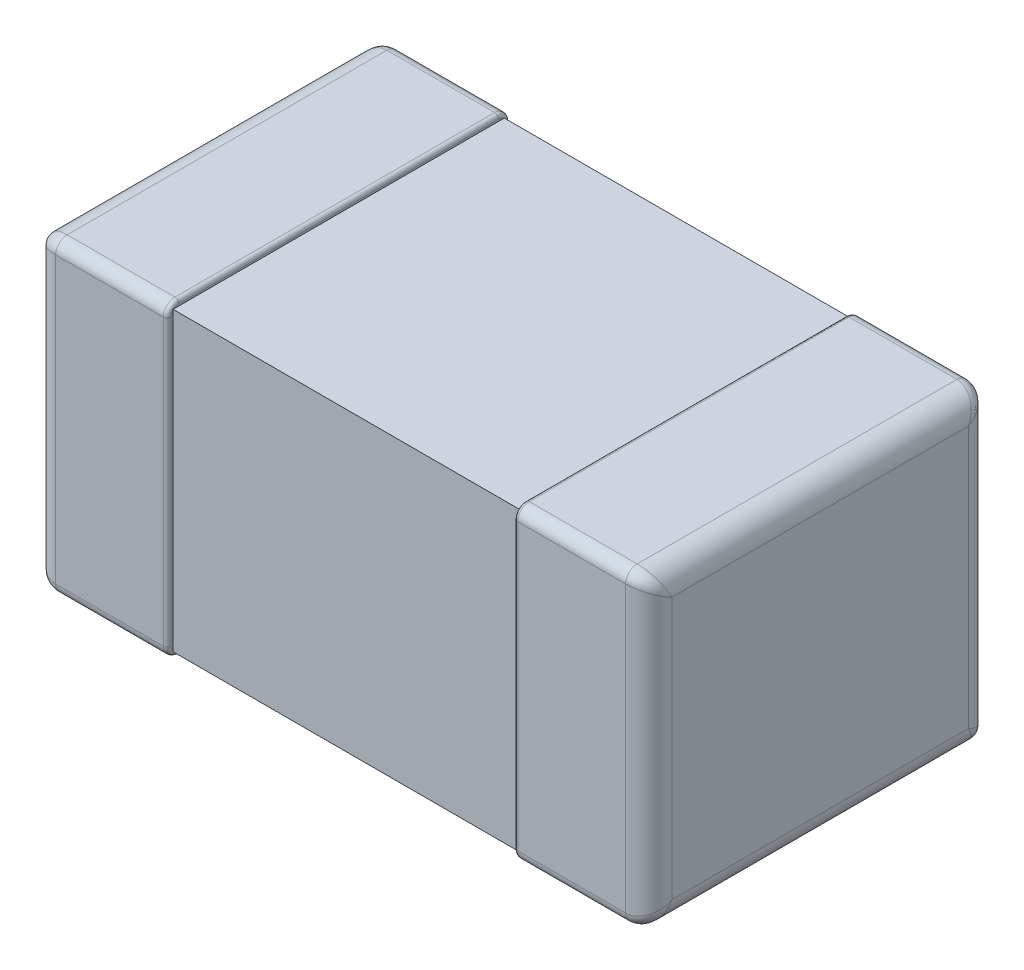
from build123d import *

# Parameters (mm, degrees)
SKETCH_1_W              = 0.9
SKETCH_1_H              = 0.77
EXTRUDE_1_DEPTH         = 0.86
SKETCH_2_W              = 0.89
SKETCH_2_H              = 0.8
EXTRUDE_2_DEPTH         = 0.35
SKETCH_3_W              = 0.89
SKETCH_3_H              = 0.8
EXTRUDE_3_DEPTH         = 0.35
MOVE_START              = -0.4
MOVE_BODY_1_DEPTH       = 0.8
MOVE_BODY_1_2_OUTLINE_W = 0.35
MOVE_BODY_1_2_OUTLINE_H = 0.86
MOVE_BODY_1_2_DEPTH     = 0.015
MOVE_START_2            = 0.385
MOVE_BODY_1_3_OUTLINE_W = 0.35
MOVE_BODY_1_3_OUTLINE_H = 0.86
MOVE_BODY_1_3_DEPTH     = 0.015
MOVE_START_3            = -0.385
MOVE_BODY_1_4_DEPTH     = 0.77
MOVE_BODY_1_5_OUTLINE_W = 0.35
MOVE_BODY_1_5_OUTLINE_H = 0.89
MOVE_BODY_1_5_DEPTH     = 0.8
FILLET_1_R              = 0.06
FILLET_2_R              = 0.03
FILLET_3_R              = 0.01


# Read off the part's stored shape, not the designer's step: Тело-Переместить/Копировать1
with BuildPart() as part:
    # Эскиз1 → Бобышка-Вытянуть1 (new body)
    with BuildSketch(Plane.XY):
        Rectangle(SKETCH_1_W, SKETCH_1_H)
    extrude(amount=EXTRUDE_1_DEPTH)

    # Эскиз2 → Бобышка-Вытянуть2 (add)
    with BuildSketch(Plane(origin=(0.45, 0, 0), x_dir=(0, 0, -1), z_dir=(1, 0, 0))):
        with Locations((-0.43, 0)):
            Rectangle(SKETCH_2_W, SKETCH_2_H)
    extrude(amount=EXTRUDE_2_DEPTH)

    # Эскиз3 → Бобышка-Вытянуть3 (add)
    with BuildSketch(Plane.ZY.offset(0.45)):
        with Locations((0.43, 0)):
            Rectangle(SKETCH_3_W, SKETCH_3_H)
    extrude(amount=EXTRUDE_3_DEPTH)

    # Move Body 1 outline → Move Body 1 (cut)
    with BuildSketch(Plane(origin=(0, 0, 0), x_dir=(1, 0, 0), z_dir=(0, 1, 0)).offset(MOVE_START)):
        Polygon((0.8, -0.015), (0.8, 0.015), (0.45, 0.015), (0.45, 0), (0.175, 0), (0.175, -0.015), align=None)
        Polygon((-0.45, -0.86), (-0.175, -0.86), (-0.175, 0), (-0.45, 0), (-0.45, 0.015), (-0.8, 0.015), (-0.8, -0.875), (-0.45, -0.875), align=None)
    extrude(amount=MOVE_BODY_1_DEPTH, mode=Mode.SUBTRACT)

    # Move Body 1 2 outline → Move Body 1 2 (cut)
    with BuildSketch(Plane(origin=(0, 0, 0), x_dir=(1, 0, 0), z_dir=(0, 1, 0)).offset(MOVE_START)):
        with Locations((0.625, -0.445)):
            Rectangle(MOVE_BODY_1_2_OUTLINE_W, MOVE_BODY_1_2_OUTLINE_H)
    extrude(amount=MOVE_BODY_1_2_DEPTH, mode=Mode.SUBTRACT)

    # Move Body 1 3 outline → Move Body 1 3 (cut)
    with BuildSketch(Plane(origin=(0, 0, 0), x_dir=(1, 0, 0), z_dir=(0, 1, 0)).offset(MOVE_START_2)):
        with Locations((0.625, -0.445)):
            Rectangle(MOVE_BODY_1_3_OUTLINE_W, MOVE_BODY_1_3_OUTLINE_H)
    extrude(amount=MOVE_BODY_1_3_DEPTH, mode=Mode.SUBTRACT)

    # Move Body 1 4 outline → Move Body 1 4 (add)
    with BuildSketch(Plane(origin=(0, 0, 0), x_dir=(1, 0, 0), z_dir=(0, 1, 0)).offset(MOVE_START_3)):
        Polygon((0.8, -0.875), (1.075, -0.875), (1.075, -0.89), (1.425, -0.89), (1.425, 0), (1.075, 0), (1.075, -0.015), (0.8, -0.015), align=None)
        Polygon((0.175, -0.875), (0.45, -0.875), (0.45, -0.86), (-0.175, -0.86), (-0.175, -0.89), (0.175, -0.89), align=None)
    extrude(amount=MOVE_BODY_1_4_DEPTH)

    # Move Body 1 5 outline → Move Body 1 5 (add)
    with BuildSketch(Plane(origin=(0, 0, 0), x_dir=(1, 0, 0), z_dir=(0, 1, 0)).offset(MOVE_START)):
        with Locations((1.25, -0.445)):
            Rectangle(MOVE_BODY_1_5_OUTLINE_W, MOVE_BODY_1_5_OUTLINE_H)
        with Locations((0, -0.445)):
            Rectangle(MOVE_BODY_1_5_OUTLINE_W, MOVE_BODY_1_5_OUTLINE_H)
    extrude(amount=MOVE_BODY_1_5_DEPTH)

    # Скругление1
    fillet_1_edges = [part.edges().sort_by_distance(p)[0] for p in [
        (1.425, 0, 0),
        (1.425, 0.4, 0.445),
        (1.425, 0, 0.89),
        (1.425, -0.4, 0.445),
        (-0.175, 0, 0.89),
        (-0.175, 0.4, 0.445),
        (-0.175, 0, 0),
        (-0.175, -0.4, 0.445),
    ]]
    fillet(fillet_1_edges, radius=FILLET_1_R)

    # Скругление2
    fillet_2_edges = [part.edges().sort_by_distance(p)[0] for p in [
        (1.22, 0.4, 0),
        (1.22, -0.4, 0),
        (1.22, 0.4, 0.89),
        (1.22, -0.4, 0.89),
        (0.03, 0.4, 0),
        (0.03, 0.4, 0.89),
        (0.03, -0.4, 0),
        (0.03, -0.4, 0.89),
        (1.410797761, -0.378762934, 0.868762934),
        (1.410797761, 0.378762934, 0.868762934),
        (1.410797761, -0.378762934, 0.021237066),
        (1.410797761, 0.378762934, 0.021237066),
        (-0.160797761, -0.378762934, 0.868762934),
        (-0.160797761, -0.378762934, 0.021237066),
        (-0.160797761, 0.378762934, 0.868762934),
        (-0.160797761, 0.378762934, 0.021237066),
    ]]
    fillet(fillet_2_edges, radius=FILLET_2_R)

    # Скругление3
    fillet_3_edges = [part.edges().sort_by_distance(p)[0] for p in [
        (1.075, 0.4, 0.445),
        (1.075, 0, 0),
        (1.075, -0.4, 0.445),
        (1.075, 0, 0.89),
        (1.075, -0.391213203, 0.008786797),
        (1.075, -0.391213203, 0.881213203),
        (1.075, 0.391213203, 0.881213203),
        (1.075, 0.391213203, 0.008786797),
        (0.175, 0, 0),
        (0.175, 0, 0.89),
        (0.175, -0.4, 0.445),
        (0.175, 0.4, 0.445),
        (0.175, -0.391213203, 0.881213203),
        (0.175, -0.391213203, 0.008786797),
        (0.175, 0.391213203, 0.881213203),
        (0.175, 0.391213203, 0.008786797),
    ]]
    fillet(fillet_3_edges, radius=FILLET_3_R)


solid = part.part
